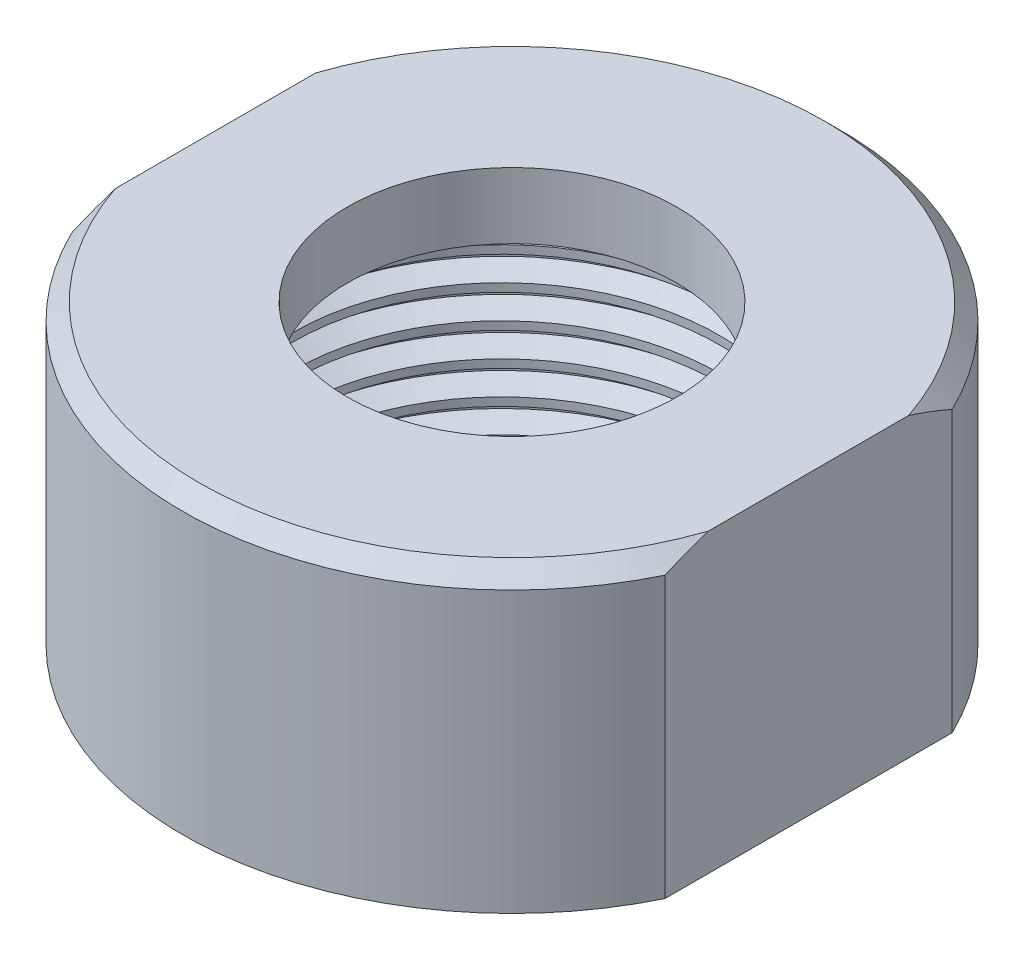
from build123d import *

# Parameters (mm, degrees)
SKETCH1_R           = 10
SKETCH1_R_2         = 7
BOSS_EXTRUDE1_DEPTH = 7
SKETCH3_R           = 10
SKETCH3_R_2         = 5
BOSS_EXTRUDE2_DEPTH = 2
CHAMFER1_SIZE       = 0.5
THREAD1_PITCH       = 1
SKETCH8_OUTSIDE_W   = 27.936
SKETCH8_OUTSIDE_H   = 27.936
SKETCH8_OUTSIDE_W_2 = 18
SKETCH8_OUTSIDE_H_2 = 22.269342086
CUT_EXTRUDE2_DEPTH  = 10


with BuildPart() as part:
    # Sketch1 → Boss-Extrude1 (new body)
    with BuildSketch(Plane(origin=(0, 0, 0), x_dir=(1, 0, 0), z_dir=(0, 1, 0))):
        with Locations(Location((0, 0, 0), (0, 0, 270))):
            Circle(SKETCH1_R)
        with Locations(Location((0, 0, 0), (0, 0, 270))):
            Circle(SKETCH1_R_2, mode=Mode.SUBTRACT)
    extrude(amount=BOSS_EXTRUDE1_DEPTH)

    # Sketch3 → Boss-Extrude2 (add)
    with BuildSketch(Plane(origin=(0, 7, 0), x_dir=(1, 0, 0), z_dir=(0, 1, 0))):
        with Locations(Location((0, 0, 0), (0, 0, 270))):
            Circle(SKETCH3_R)
        with Locations(Location((0, 0, 0), (0, 0, 270))):
            Circle(SKETCH3_R_2, mode=Mode.SUBTRACT)
    extrude(amount=BOSS_EXTRUDE2_DEPTH)

    # Chamfer1
    chamfer1_edges = [part.edges().sort_by_distance(p)[0] for p in [
        (0, 9, -10),
    ]]
    chamfer(chamfer1_edges, length=CHAMFER1_SIZE)

    # Thread1: the profile of Thread Profile1 profile screwed along a right-hand helix of 7 turns, 8 arcs to a turn; built about Z, then put on its axis
    thread1_z = Axis((0, 0, 0), (0, 0, 1))
    thread1_corners = [(7.0003, 0, -0.000173205), (7.0003, 0, 0.875173202), (6.458734125, 0, 0.562499999), (6.458734125, 0, 0.312499999)]
    with BuildLine(mode=Mode.PRIVATE) as thread1_profile:
        Line(thread1_corners[0], thread1_corners[1])
        Line(thread1_corners[1], thread1_corners[2])
        Line(thread1_corners[2], thread1_corners[3])
        Line(thread1_corners[3], thread1_corners[0])
    thread1_cap = Face(thread1_profile.wire())
    thread1_turn_angles = [0, 22.5, 45, 67.5, 90, 112.5, 135, 157.5, 180, 202.5, 225, 247.5, 270, 292.5, 315, 337.5, 360]
    thread1_turn_weights = [1, 0.9238795325112867, 1, 0.9238795325112867, 1, 0.9238795325112867, 1, 0.9238795325112867, 1, 0.9238795325112867, 1, 0.9238795325112867, 1, 0.9238795325112867, 1, 0.9238795325112867, 1]
    thread1_turn_rails = [Edge.make_bspline([Vector(p[0], p[1], 0).rotate(thread1_z, thread1_turn_angles[k]) / thread1_turn_weights[k] + Vector(0, 0, p[2] + THREAD1_PITCH * thread1_turn_angles[k] / 360) for k in range(17)], [0, 0, 0, 1, 1, 2, 2, 3, 3, 4, 4, 5, 5, 6, 6, 7, 7, 8, 8, 8], 2, thread1_turn_weights) for p in thread1_corners]
    thread1_turn_sides = [Face.make_surface_from_curves(thread1_turn_rails[p[0]], thread1_turn_rails[p[1]]) for p in [(0, 1), (1, 2), (2, 3), (3, 0)]]
    thread1 = Plane(origin=(0, 0, 0), x_dir=(1, 0, 0), z_dir=(0, 1, 0)) * Solid(Shell([*[p.moved(Location((0, 0, THREAD1_PITCH * i))) for i in range(7) for p in thread1_turn_sides], thread1_cap, thread1_cap.rotate(thread1_z, 2520).moved(Location((0, 0, THREAD1_PITCH * 2520 / 360)))]))
    add(thread1)

    # Sketch8 outside → Cut-Extrude2 (cut)
    with BuildSketch(Plane(origin=(0, 9, 0), x_dir=(1, 0, 0), z_dir=(0, 1, 0))):
        Rectangle(SKETCH8_OUTSIDE_W, SKETCH8_OUTSIDE_H)
        with Locations((0, -0.024747343)):
            Rectangle(SKETCH8_OUTSIDE_W_2, SKETCH8_OUTSIDE_H_2, mode=Mode.SUBTRACT)
    extrude(amount=-CUT_EXTRUDE2_DEPTH, mode=Mode.SUBTRACT)


solid = part.part
